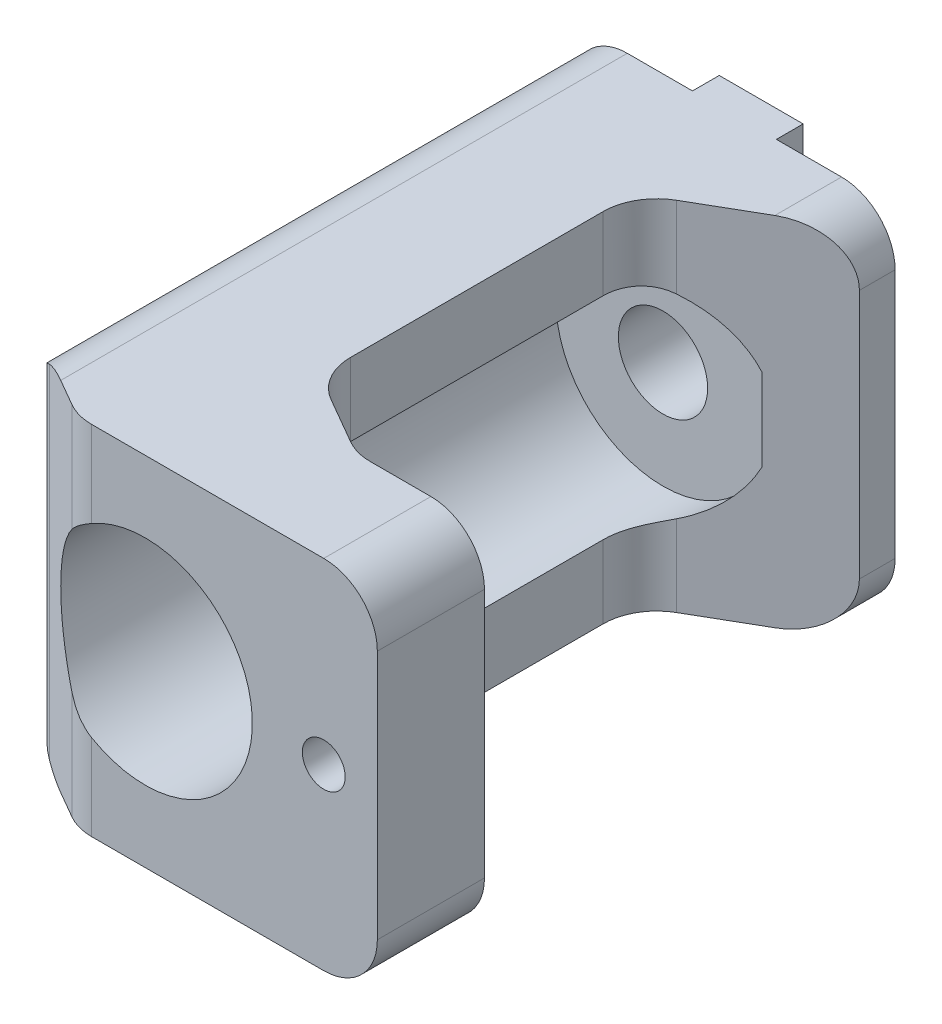
from build123d import *
from build123d.topology import SkipClean

# Parameters (mm, degrees)
BOSS_EXTRU_1_DEPTH           = 10
ENL_V_MAT_EXTRU_1_DEPTH      = 29.854594898
ENL_V_MAT_EXTRU_1_DEPTH_BACK = 29.854594898
ESQUISSE2_R                  = 2.5
ENL_V_START                  = 4
ESQUISSE3_R                  = 6
ENL_V_MAT_EXTRU_2_DEPTH      = 25.390139133
ESQUISSE5_W                  = 1.5
ESQUISSE5_H                  = 4
ENL_V_MAT_EXTRU_3_DEPTH      = 30.220241272
BOSS_EXTRU_2_REACH           = 35.257
ENL_V_START_2                = -20
ESQUISSE7_R                  = 1.2
ESQUISSE7_R_2                = 6
ENL_V_MAT_EXTRU_4_DEPTH      = 20
CONG_1_START                 = -10
CONG_1_DEPTH                 = 20
CONG_1_2_DEPTH               = 20
CONG_1_START_2               = 5.75277665
CONG_1_3_OUTLINE_R           = 6
CONG_1_3_DEPTH               = 28.24722335
CONG_1_START_3               = -1.5
CONG_1_4_DEPTH               = 7.669577456
CONG_1_5_DEPTH               = 2.598076411
CONG_1_START_4               = 22.494446401
CONG_1_6_DEPTH               = 2.598076411
CONG_1_7_DEPTH               = 20


with BuildPart() as part:
    # Esquisse1 → Boss.-Extru.1 (new, symmetric)
    with BuildSketch(Plane(origin=(0, 0, 0), x_dir=(1, 0, 0), z_dir=(0, 1, 0))):
        Polygon((2.35, 0), (9, 0), (9, -2), (1, -6.618802154), (1, -25), (-9, -25), (-9, 0), (-2.35, 0), (-2.35, 1.5), (2.35, 1.5), align=None)
    extrude(amount=BOSS_EXTRU_1_DEPTH, both=True)

    # Esquisse2 → Enlèv. mat.-Extru.1 (cut, two sides: drawn at the far end of the back side and taken through both)
    with BuildSketch(Plane(origin=(-1.372446517, 0, 0), x_dir=(1, 0, 0), z_dir=(0, 0, 1)).offset(-ENL_V_MAT_EXTRU_1_DEPTH_BACK)):
        with Locations(Location((1.372446517, 0, 0), (0, 0, 340.051556411))):
            Circle(ESQUISSE2_R)
    extrude(amount=ENL_V_MAT_EXTRU_1_DEPTH + ENL_V_MAT_EXTRU_1_DEPTH_BACK, mode=Mode.SUBTRACT)

    # Esquisse3 → Enlèv. mat.-Extru.2 (cut, through all)
    with BuildSketch(Plane.XY.offset(ENL_V_START)):
        Circle(ESQUISSE3_R)
    extrude(amount=ENL_V_MAT_EXTRU_2_DEPTH, mode=Mode.SUBTRACT)

    # Esquisse5 → Enlèv. mat.-Extru.3 (cut, through all)
    with BuildSketch(Plane.ZY.offset(2.35)):
        with Locations((-0.75, 0)):
            Rectangle(ESQUISSE5_W, ESQUISSE5_H)
    extrude(amount=-ENL_V_MAT_EXTRU_3_DEPTH, mode=Mode.SUBTRACT)

    # Boss.-Extru.2: up to this face of the body (flat: up to its plane)
    boss_extru_2_end = Plane(part.part.faces().sort_by_distance((-2.923443816, -10, 10.980550797))[0])
    # Esquisse6 → Boss.-Extru.2 (add, up to the picked face)
    with BuildSketch(Plane(origin=(0, 10, 0), x_dir=(1, 0, 0), z_dir=(0, 1, 0)), mode=Mode.PRIVATE) as boss_extru_2_sk1:
        Polygon((-9, -18.452994616), (5.803847577, -27), (13, -27), (13, -33), (-3.803847577, -33), (-9, -30), align=None)
    boss_extru_2_tool1 = split(extrude(boss_extru_2_sk1.sketch, amount=-BOSS_EXTRU_2_REACH, mode=Mode.PRIVATE), bisect_by=boss_extru_2_end, keep=Keep.BOTH, mode=Mode.PRIVATE)
    add(boss_extru_2_tool1.solids().sort_by(Axis((0.338478, 10, 27.943024), (0, -1, 0)))[0])

    # Esquisse7 → Enlèv. mat.-Extru.4 (cut)
    with BuildSketch(Plane.XY.offset(33).offset(ENL_V_START_2)):
        with Locations((10, 0)):
            Circle(ESQUISSE7_R)
        with Locations(Location((0, 0, 0), (0, 0, 230.656026391))):
            Circle(ESQUISSE7_R_2)
    extrude(amount=ENL_V_MAT_EXTRU_4_DEPTH, mode=Mode.SUBTRACT)

    # Congé1: read off the stored shape, not the designer's step
    # Congé1 outline → Congé1 (cut)
    with BuildSketch(Plane(origin=(0, 0, 0), x_dir=(1, 0, 0), z_dir=(0, 1, 0)).offset(CONG_1_START)):
        with BuildLine():
            Line((-9, -30), (-7.5, -30.866025404))
            ThreePointArc((-7.5, -30.866025404), (-8.598076211, -29.767949192), (-9, -28.267949192))
            Line((-9, -28.267949192), (-9, -30))
        make_face()
    extrude(amount=CONG_1_DEPTH, mode=Mode.SUBTRACT)

    # Cong_1 2 outline → Cong_1 2 (add)
    with BuildSketch(Plane(origin=(0, 0, 0), x_dir=(1, 0, 0), z_dir=(0, 1, 0)).offset(CONG_1_START)):
        with BuildLine():
            Line((5.803847577, -27), (6.607695155, -27))
            ThreePointArc((6.607695155, -27), (5.83123802, -26.897777479), (5.107695155, -26.598076211))
            Line((5.107695155, -26.598076211), (5.803847577, -27))
        make_face()
    extrude(amount=CONG_1_2_DEPTH)

    # Cong_1 3 outline → Cong_1 3 (cut)
    with BuildSketch(Plane.XY.offset(CONG_1_START_2)):
        with BuildLine():
            Line((-9, 10), (-9, 7))
            ThreePointArc((-9, 7), (-8.121320344, 9.121320344), (-6, 10))
            Line((-6, 10), (-9, 10))
        make_face()
        with BuildLine():
            ThreePointArc((-6, -10), (-8.121320344, -9.121320344), (-9, -7))
            Line((-9, -7), (-9, -10))
            Line((-9, -10), (-6, -10))
        make_face()
        Circle(CONG_1_3_OUTLINE_R)
        with BuildLine():
            Line((13, 10), (10, 10))
            ThreePointArc((10, 10), (12.121320344, 9.121320344), (13, 7))
            Line((13, 7), (13, 10))
        make_face()
        with BuildLine():
            ThreePointArc((13, -7), (12.121320344, -9.121320344), (10, -10))
            Line((10, -10), (13, -10))
            Line((13, -10), (13, -7))
        make_face()
    extrude(amount=CONG_1_3_DEPTH, mode=Mode.SUBTRACT)

    # Cong_1 4 outline → Cong_1 4 (cut)
    with BuildSketch(Plane.XY.offset(CONG_1_START_3)):
        with BuildLine():
            Line((-9, 10), (-9, 7))
            ThreePointArc((-9, 7), (-8.121320344, 9.121320344), (-6, 10))
            Line((-6, 10), (-9, 10))
        make_face()
        with BuildLine():
            ThreePointArc((-6, -10), (-8.121320344, -9.121320344), (-9, -7))
            Line((-9, -7), (-9, -10))
            Line((-9, -10), (-6, -10))
        make_face()
        with BuildLine():
            Line((9, 10), (6, 10))
            ThreePointArc((6, 10), (8.121320344, 9.121320344), (9, 7))
            Line((9, 7), (9, 10))
        make_face()
        with BuildLine():
            ThreePointArc((9, -7), (8.121320344, -9.121320344), (6, -10))
            Line((6, -10), (9, -10))
            Line((9, -10), (9, -7))
        make_face()
    extrude(amount=CONG_1_4_DEPTH, mode=Mode.SUBTRACT)

    # Cong_1 5 outline → Cong_1 5 (add)
    with SkipClean():  # the faces are left unmerged after this step: merging them gives an invalid solid
        with BuildSketch(Plane.XY.offset(CONG_1_START_2)):
            with BuildLine():
                Line((6, 10), (1, 10))
                Line((1, 10), (1, 5.916079783))
                ThreePointArc((1, 5.916079783), (6, 0), (1, -5.916079783))
                Line((1, -5.916079783), (1, -10))
                Line((1, -10), (6, -10))
                ThreePointArc((6, -10), (8.121320344, -9.121320344), (9, -7))
                Line((9, -7), (9, 7))
                ThreePointArc((9, 7), (8.121320344, 9.121320344), (6, 10))
            make_face()
        extrude(amount=CONG_1_5_DEPTH)

    # Cong_1 6 outline → Cong_1 6 (add)
    with SkipClean():  # the faces are left unmerged after this step: merging them gives an invalid solid
        with BuildSketch(Plane.XY.offset(CONG_1_START_4)):
            with BuildLine():
                Line((6, 10), (1, 10))
                Line((1, 10), (1, 5.916079783))
                ThreePointArc((1, 5.916079783), (6, 0), (1, -5.916079783))
                Line((1, -5.916079783), (1, -10))
                Line((1, -10), (6, -10))
                ThreePointArc((6, -10), (8.121320344, -9.121320344), (9, -7))
                Line((9, -7), (9, 7))
                ThreePointArc((9, 7), (8.121320344, 9.121320344), (6, 10))
            make_face()
        extrude(amount=CONG_1_6_DEPTH)

    # Cong_1 7 outline → Cong_1 7 (cut)
    with SkipClean():  # the faces are left unmerged after this step: merging them gives an invalid solid
        with BuildSketch(Plane(origin=(0, 0, 0), x_dir=(1, 0, 0), z_dir=(0, 1, 0)).offset(CONG_1_START)):
            with BuildLine():
                ThreePointArc((-3, -33), (-3.776457135, -32.897777479), (-4.5, -32.598076211))
                Line((-4.5, -32.598076211), (-3.803847577, -33))
                Line((-3.803847577, -33), (-3, -33))
            make_face()
            with BuildLine():
                ThreePointArc((1, -22.494446501), (1.401923789, -23.994446501), (2.5, -25.092522712))
                Line((2.5, -25.092522712), (9, -25.092522812))
                Line((9, -25.092522812), (9, -22.494446401))
                Line((9, -22.494446401), (1, -22.494446501))
            make_face()
            with BuildLine():
                Line((9, -5.75277665), (2.5, -5.75277675))
                ThreePointArc((2.5, -5.75277675), (1.401923789, -6.850852961), (1, -8.350852961))
                Line((1, -8.350852961), (9, -8.350853061))
                Line((9, -8.350853061), (9, -5.75277665))
            make_face()
        extrude(amount=CONG_1_7_DEPTH, mode=Mode.SUBTRACT)


solid = part.part
